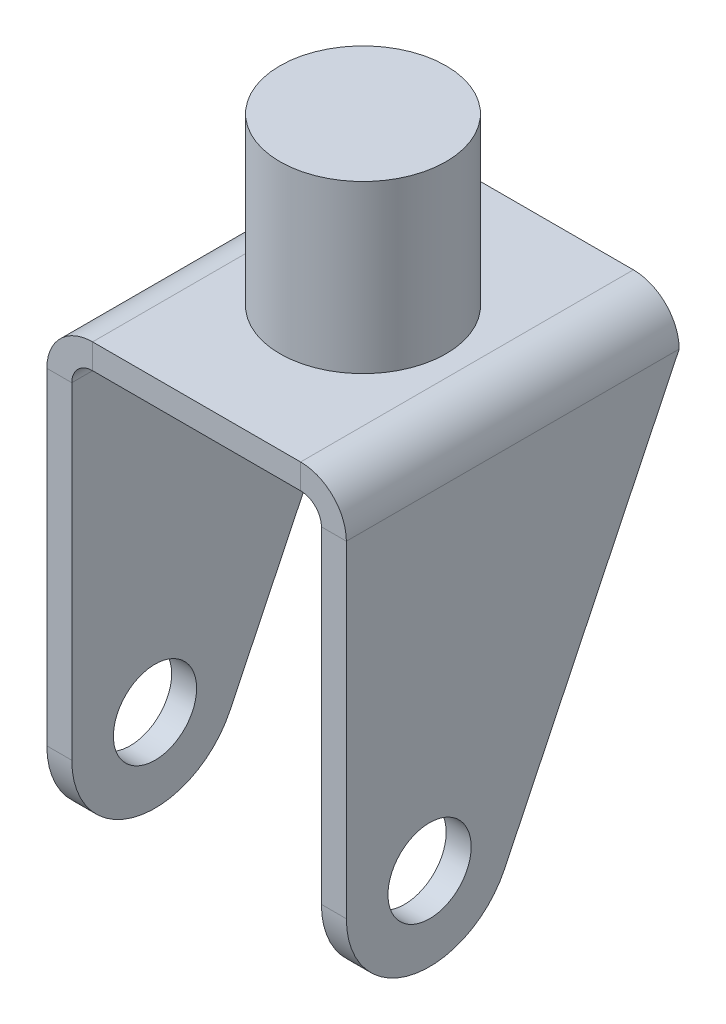
from build123d import *

# Parameters (mm, degrees)
BASE_FLANGE1_DEPTH  = 50.8
SKETCH8_R           = 12.7
CUT_EXTRUDE2_DEPTH  = 202.491653782
SKETCH9_R           = 25.36182522
BOSS_EXTRUDE1_DEPTH = 50.8


# Sheet-metal steps are written as plain solids
with BuildPart() as part:
    # Sketch2 → Base-Flange1 (new, symmetric)
    with BuildSketch(Plane.XY):
        with BuildLine():
            Line((38.1, 0), (38.1, 158.242))
            ThreePointArc((38.1, 158.242), (36.240128061, 162.732128061), (31.75, 164.592))
            Line((31.75, 164.592), (-31.75, 164.592))
            ThreePointArc((-31.75, 164.592), (-36.240128061, 162.732128061), (-38.1, 158.242))
            Line((-38.1, 158.242), (-38.1, 0))
            Line((-38.1, 0), (-45.72, 0))
            Line((-45.72, 0), (-45.72, 158.242))
            ThreePointArc((-45.72, 158.242), (-41.628281733, 168.120281733), (-31.75, 172.212))
            Line((-31.75, 172.212), (31.75, 172.212))
            ThreePointArc((31.75, 172.212), (41.628281733, 168.120281733), (45.72, 158.242))
            Line((45.72, 158.242), (45.72, 0))
            Line((45.72, 0), (38.1, 0))
        make_face()
    extrude(amount=BASE_FLANGE1_DEPTH, both=True)

    # Sketch8 → Cut-Extrude2 (cut, through all)
    with BuildSketch(Plane(origin=(45.72, 0, 0), x_dir=(0, 0, -1), z_dir=(1, 0, 0))):
        with BuildLine():
            Line((50.8, 0), (50.8, 158.242))
            Line((50.8, 158.242), (-2.510257588, 47.410018515))
            ThreePointArc((-2.510257588, 47.410018515), (-31.046261716, 33.655514771), (-50.8, 58.42))
            Line((-50.8, 58.42), (-50.8, 0))
            Line((-50.8, 0), (50.8, 0))
        make_face()
        with Locations((-25.4, 58.42)):
            Circle(SKETCH8_R)
    extrude(amount=-CUT_EXTRUDE2_DEPTH, mode=Mode.SUBTRACT)

    # Sketch9 → Boss-Extrude1 (add)
    with BuildSketch(Plane(origin=(0, 172.212, 0), x_dir=(1, 0, 0), z_dir=(0, 1, 0))):
        with Locations(Location((0, 0, 0), (0, 0, 270))):
            Circle(SKETCH9_R)
    extrude(amount=BOSS_EXTRUDE1_DEPTH)


solid = part.part
